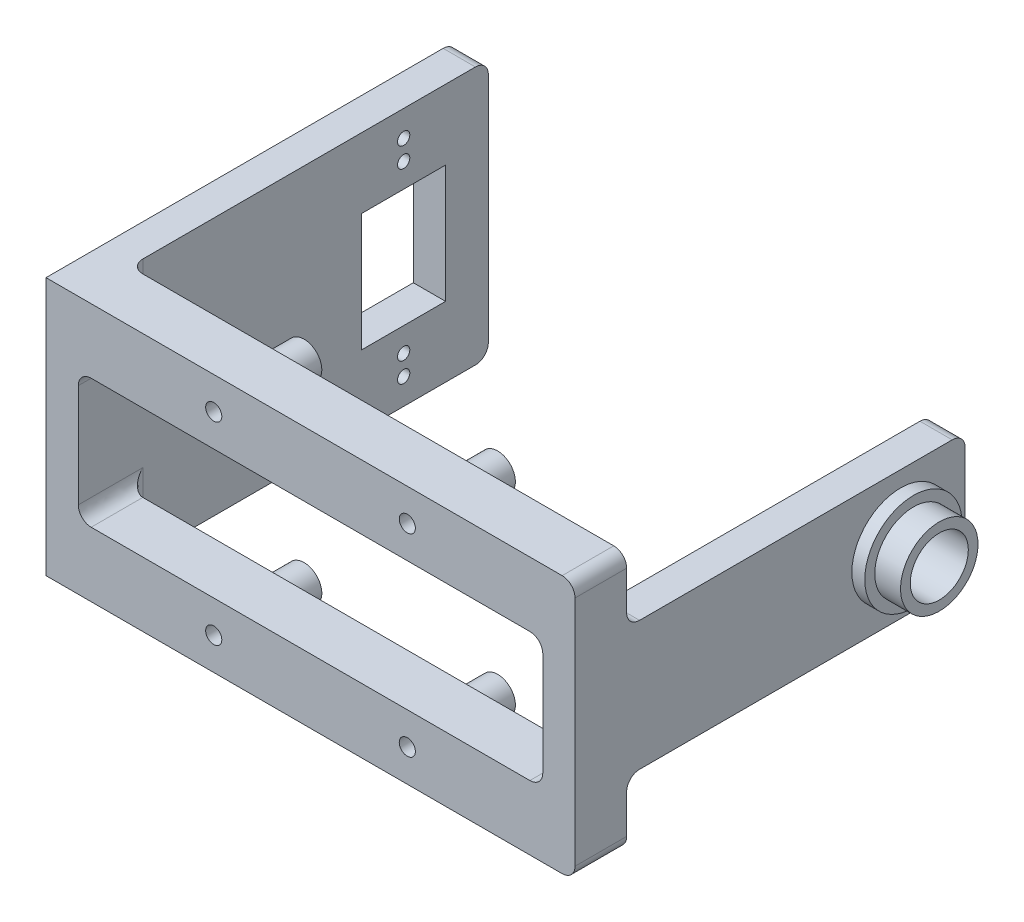
from build123d import *

# Parameters (mm, degrees)
SKETCH1_W                = 60.45
SKETCH1_H                = 20
BOSS_EXTRUDE1_DEPTH      = 5
SKETCH2_R                = 7.545
BOSS_EXTRUDE2_DEPTH      = 2
SKETCH3_R                = 6
BOSS_EXTRUDE3_DEPTH      = 4
CUT_EXTRUDE1_REACH       = 66.616
SKETCH4_R                = 4.5
SKETCH5_W                = 8
SKETCH5_H                = 10
BOSS_EXTRUDE4_DEPTH      = 81.99
BOSS_EXTRUDE5_DEPTH      = 55.55
BOSS_EXTRUDE5_DEPTH_BACK = 8
SKETCH6_W                = 5
SKETCH6_H                = 40
SKETCH7_R                = 2.75
BOSS_EXTRUDE6_DEPTH      = 6
CUT_EXTRUDE2_REACH       = 98.347
SKETCH8_R                = 1.25
CUT_EXTRUDE3_REACH       = 114.609
SKETCH9_R                = 0.95
SKETCH9_W                = 13
SKETCH9_H                = 18.3
FILLET1_R                = 2
FILLET2_R                = 2


with BuildPart() as part:
    # Sketch1 → Boss-Extrude1 (new body)
    with BuildSketch(Plane(origin=(0, 0, 0), x_dir=(0, 0, -1), z_dir=(1, 0, 0))):
        with Locations((30.225, 10)):
            Rectangle(SKETCH1_W, SKETCH1_H)
    extrude(amount=BOSS_EXTRUDE1_DEPTH)

    # Sketch2 → Boss-Extrude2 (add)
    with BuildSketch(Plane(origin=(5, 0, 0), x_dir=(0, 0, -1), z_dir=(1, 0, 0))):
        with Locations((50.45, 10)):
            Circle(SKETCH2_R)
    extrude(amount=BOSS_EXTRUDE2_DEPTH)

    # Sketch3 → Boss-Extrude3 (add)
    with BuildSketch(Plane(origin=(7, 0, 0), x_dir=(0, 0, -1), z_dir=(1, 0, 0))):
        with Locations((50.45, 10)):
            Circle(SKETCH3_R)
    extrude(amount=BOSS_EXTRUDE3_DEPTH)

    # Sketch4 → Cut-Extrude1 (cut, up to next)
    with BuildSketch(Plane(origin=(11, 0, 0), x_dir=(0, 0, -1), z_dir=(1, 0, 0)), mode=Mode.PRIVATE) as cut_extrude1_sk1:
        with Locations((50.45, 10)):
            Circle(SKETCH4_R)
    cut_extrude1_tool1 = extrude(cut_extrude1_sk1.sketch, amount=-CUT_EXTRUDE1_REACH, mode=Mode.PRIVATE) & part.part
    add(cut_extrude1_tool1.solids().sort_by_distance((11, 10, -50.45))[0], mode=Mode.SUBTRACT)

    # Sketch5 → Boss-Extrude4 (add)
    with BuildSketch(Plane(origin=(5, 0, 0), x_dir=(0, 0, -1), z_dir=(1, 0, 0))):
        with Locations((4, 25)):
            Rectangle(SKETCH5_W, SKETCH5_H)
        with Locations((4, -5)):
            Rectangle(SKETCH5_W, SKETCH5_H)
    extrude(amount=-BOSS_EXTRUDE4_DEPTH)

    # Sketch6 → Boss-Extrude5 (add, two sides: drawn at the far end of the back side and taken through both)
    with BuildSketch(Plane(origin=(0, 0, -8), x_dir=(-1, 0, 0), z_dir=(0, 0, -1)).offset(-BOSS_EXTRUDE5_DEPTH_BACK)):
        with Locations((74.49, 10)):
            Rectangle(SKETCH6_W, SKETCH6_H)
    extrude(amount=BOSS_EXTRUDE5_DEPTH + BOSS_EXTRUDE5_DEPTH_BACK)

    # Sketch7 → Boss-Extrude6 (add)
    with BuildSketch(Plane(origin=(0, 0, -8), x_dir=(-1, 0, 0), z_dir=(0, 0, -1))):
        with Locations((20.995, 24.99)):
            Circle(SKETCH7_R)
        with Locations((50.995, 24.99)):
            Circle(SKETCH7_R)
        with Locations((50.995, -4.99)):
            Circle(SKETCH7_R)
        with Locations((20.995, -4.99)):
            Circle(SKETCH7_R)
    extrude(amount=BOSS_EXTRUDE6_DEPTH)

    # Sketch8 → Cut-Extrude2 (cut, up to next)
    with BuildSketch(Plane(origin=(0, 0, -14), x_dir=(-1, 0, 0), z_dir=(0, 0, -1)), mode=Mode.PRIVATE) as cut_extrude2_sk1:
        with Locations((20.995, 24.99)):
            Circle(SKETCH8_R)
    cut_extrude2_tool1 = extrude(cut_extrude2_sk1.sketch, amount=-CUT_EXTRUDE2_REACH, mode=Mode.PRIVATE) & part.part
    # Sketch8 → Cut-Extrude2 (cut, up to next)
    with BuildSketch(Plane(origin=(0, 0, -14), x_dir=(-1, 0, 0), z_dir=(0, 0, -1)), mode=Mode.PRIVATE) as cut_extrude2_sk2:
        with Locations((50.995, 24.99)):
            Circle(SKETCH8_R)
    cut_extrude2_tool2 = extrude(cut_extrude2_sk2.sketch, amount=-CUT_EXTRUDE2_REACH, mode=Mode.PRIVATE) & part.part
    # Sketch8 → Cut-Extrude2 (cut, up to next)
    with BuildSketch(Plane(origin=(0, 0, -14), x_dir=(-1, 0, 0), z_dir=(0, 0, -1)), mode=Mode.PRIVATE) as cut_extrude2_sk3:
        with Locations((50.995, -4.99)):
            Circle(SKETCH8_R)
    cut_extrude2_tool3 = extrude(cut_extrude2_sk3.sketch, amount=-CUT_EXTRUDE2_REACH, mode=Mode.PRIVATE) & part.part
    # Sketch8 → Cut-Extrude2 (cut, up to next)
    with BuildSketch(Plane(origin=(0, 0, -14), x_dir=(-1, 0, 0), z_dir=(0, 0, -1)), mode=Mode.PRIVATE) as cut_extrude2_sk4:
        with Locations((20.995, -4.99)):
            Circle(SKETCH8_R)
    cut_extrude2_tool4 = extrude(cut_extrude2_sk4.sketch, amount=-CUT_EXTRUDE2_REACH, mode=Mode.PRIVATE) & part.part
    add(cut_extrude2_tool1.solids().sort_by_distance((-20.995, 24.99, -14))[0], mode=Mode.SUBTRACT)
    add(cut_extrude2_tool2.solids().sort_by_distance((-50.995, 24.99, -14))[0], mode=Mode.SUBTRACT)
    add(cut_extrude2_tool3.solids().sort_by_distance((-50.995, -4.99, -14))[0], mode=Mode.SUBTRACT)
    add(cut_extrude2_tool4.solids().sort_by_distance((-20.995, -4.99, -14))[0], mode=Mode.SUBTRACT)

    # Sketch9 → Cut-Extrude3 (cut, up to next)
    with BuildSketch(Plane.ZY.offset(76.99), mode=Mode.PRIVATE) as cut_extrude3_sk1:
        with Locations((-50.43, 22.88)):
            Circle(SKETCH9_R)
    cut_extrude3_tool1 = extrude(cut_extrude3_sk1.sketch, amount=-CUT_EXTRUDE3_REACH, mode=Mode.PRIVATE) & part.part
    # Sketch9 → Cut-Extrude3 (cut, up to next)
    with BuildSketch(Plane.ZY.offset(76.99), mode=Mode.PRIVATE) as cut_extrude3_sk2:
        with Locations((-50.43, -2.88)):
            Circle(SKETCH9_R)
    cut_extrude3_tool2 = extrude(cut_extrude3_sk2.sketch, amount=-CUT_EXTRUDE3_REACH, mode=Mode.PRIVATE) & part.part
    # Sketch9 → Cut-Extrude3 (cut, up to next)
    with BuildSketch(Plane.ZY.offset(76.99), mode=Mode.PRIVATE) as cut_extrude3_sk3:
        with Locations((-50.43, -5.98)):
            Circle(SKETCH9_R)
    cut_extrude3_tool3 = extrude(cut_extrude3_sk3.sketch, amount=-CUT_EXTRUDE3_REACH, mode=Mode.PRIVATE) & part.part
    # Sketch9 → Cut-Extrude3 (cut, up to next)
    with BuildSketch(Plane.ZY.offset(76.99), mode=Mode.PRIVATE) as cut_extrude3_sk4:
        with Locations((-50.43, 25.98)):
            Circle(SKETCH9_R)
    cut_extrude3_tool4 = extrude(cut_extrude3_sk4.sketch, amount=-CUT_EXTRUDE3_REACH, mode=Mode.PRIVATE) & part.part
    # Sketch9 → Cut-Extrude3 (cut, up to next)
    with BuildSketch(Plane.ZY.offset(76.99), mode=Mode.PRIVATE) as cut_extrude3_sk5:
        with Locations((-50.43, 10)):
            Rectangle(SKETCH9_W, SKETCH9_H)
    cut_extrude3_tool5 = extrude(cut_extrude3_sk5.sketch, amount=-CUT_EXTRUDE3_REACH, mode=Mode.PRIVATE) & part.part
    add(cut_extrude3_tool1.solids().sort_by_distance((-76.99, 22.88, -50.43))[0], mode=Mode.SUBTRACT)
    add(cut_extrude3_tool2.solids().sort_by_distance((-76.99, -2.88, -50.43))[0], mode=Mode.SUBTRACT)
    add(cut_extrude3_tool3.solids().sort_by_distance((-76.99, -5.98, -50.43))[0], mode=Mode.SUBTRACT)
    add(cut_extrude3_tool4.solids().sort_by_distance((-76.99, 25.98, -50.43))[0], mode=Mode.SUBTRACT)
    add(cut_extrude3_tool5.solids().sort_by_distance((-76.99, 10, -50.43))[0], mode=Mode.SUBTRACT)

    # Fillet1
    fillet1_edges = [part.edges().sort_by_distance(p)[0] for p in [
        (-71.99, 20, -4),
        (-71.99, 0, -4),
        (-71.99, -5, -8),
        (-71.99, 25, -8),
        (0, 0, -4),
        (0, 20, -4),
    ]]
    fillet(fillet1_edges, radius=FILLET1_R)
    fillet1_2_edges = [part.edges().sort_by_distance(p)[0] for p in [
        (-74.49, 30, -63.55),
        (-74.49, -10, -63.55),
        (5, -10, -4),
        (5, 30, -4),
        (2.5, 0, -60.45),
        (2.5, 20, -60.45),
    ]]
    fillet(fillet1_2_edges, radius=FILLET1_R)

    # Fillet2
    fillet2_edges = [part.edges().sort_by_distance(p)[0] for p in [
        (2.5, 20, -8),
        (2.5, 0, -8),
    ]]
    fillet(fillet2_edges, radius=FILLET2_R)


solid = part.part
